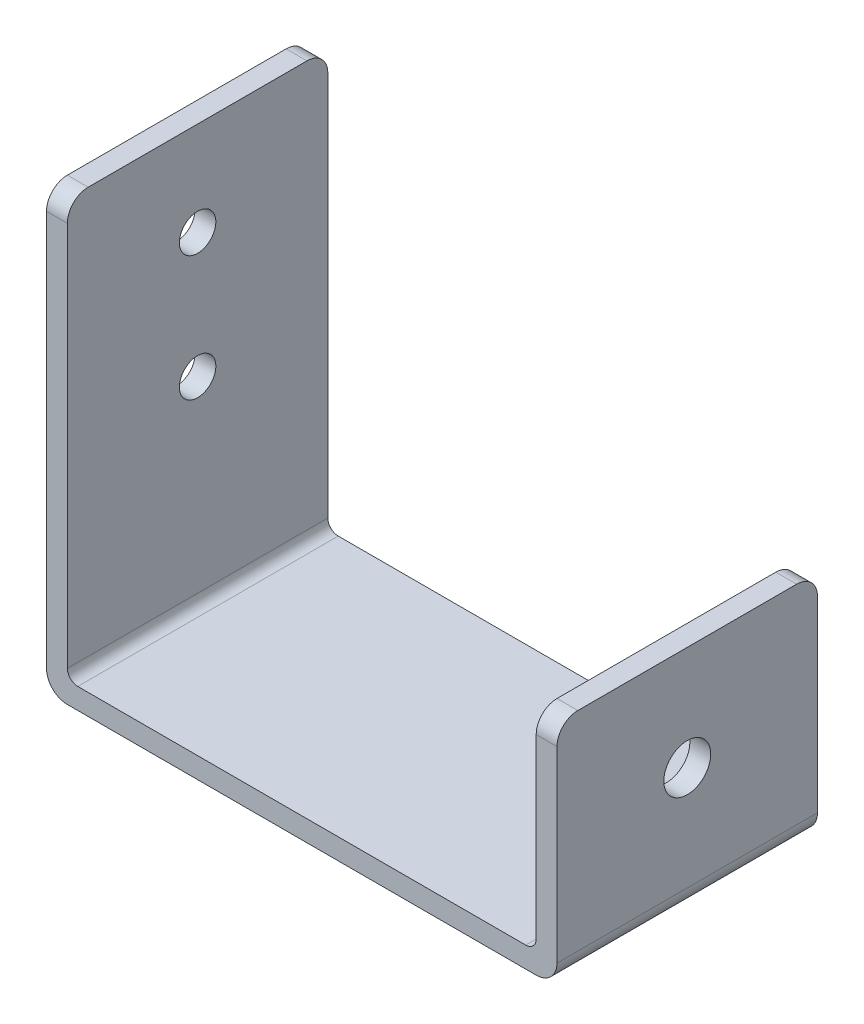
from build123d import *

# Parameters (mm, degrees)
EXTRU_MINCE1_DEPTH      = 25
CONG_1_R                = 1
CONG_2_R                = 1
CONG_3_R                = 2
CONG_4_R                = 2
ESQUISSE2_R             = 1.75
ENL_V_MAT_EXTRU_1_DEPTH = 2
ESQUISSE3_R             = 2.25
ENL_V_MAT_EXTRU_2_DEPTH = 2
CONG_12_R               = 2
CONG_13_R               = 2
CONG_15_R               = 2
CONG_16_R               = 2


with BuildPart() as part:
    # Esquisse1 → Extru.-Mince1 (new body)
    with BuildSketch(Plane.XY):
        Polygon((0, 40), (0, 0), (45, 0), (45, 20), (47, 20), (47, -2), (-2, -2), (-2, 40), align=None)
    extrude(amount=EXTRU_MINCE1_DEPTH)

    # Congé1
    cong_1_edges = [part.edges().sort_by_distance(p)[0] for p in [
        (0, 0, 12.5),
    ]]
    fillet(cong_1_edges, radius=CONG_1_R)

    # Congé2
    cong_2_edges = [part.edges().sort_by_distance(p)[0] for p in [
        (45, 0, 12.5),
    ]]
    fillet(cong_2_edges, radius=CONG_2_R)

    # Congé3
    cong_3_edges = [part.edges().sort_by_distance(p)[0] for p in [
        (47, -2, 12.5),
    ]]
    fillet(cong_3_edges, radius=CONG_3_R)

    # Congé4
    cong_4_edges = [part.edges().sort_by_distance(p)[0] for p in [
        (-2, -2, 12.5),
    ]]
    fillet(cong_4_edges, radius=CONG_4_R)

    # Esquisse2 → Enlèv. mat.-Extru.1 (cut)
    with BuildSketch(Plane.ZY.offset(2)):
        with Locations((12.5, 31)):
            Circle(ESQUISSE2_R)
        with Locations((12.5, 19)):
            Circle(ESQUISSE2_R)
    extrude(amount=-ENL_V_MAT_EXTRU_1_DEPTH, mode=Mode.SUBTRACT)

    # Esquisse3 → Enlèv. mat.-Extru.2 (cut)
    with BuildSketch(Plane(origin=(47, 0, 0), x_dir=(0, 0, -1), z_dir=(1, 0, 0))):
        with Locations((-12.5, 10)):
            Circle(ESQUISSE3_R)
    extrude(amount=-ENL_V_MAT_EXTRU_2_DEPTH, mode=Mode.SUBTRACT)

    # Congé12
    cong_12_edges = [part.edges().sort_by_distance(p)[0] for p in [
        (46, 20, 0),
    ]]
    fillet(cong_12_edges, radius=CONG_12_R)

    # Congé13
    cong_13_edges = [part.edges().sort_by_distance(p)[0] for p in [
        (46, 20, 25),
    ]]
    fillet(cong_13_edges, radius=CONG_13_R)

    # Congé15
    cong_15_edges = [part.edges().sort_by_distance(p)[0] for p in [
        (-1, 40, 0),
    ]]
    fillet(cong_15_edges, radius=CONG_15_R)

    # Congé16
    cong_16_edges = [part.edges().sort_by_distance(p)[0] for p in [
        (-1, 40, 25),
    ]]
    fillet(cong_16_edges, radius=CONG_16_R)


solid = part.part
